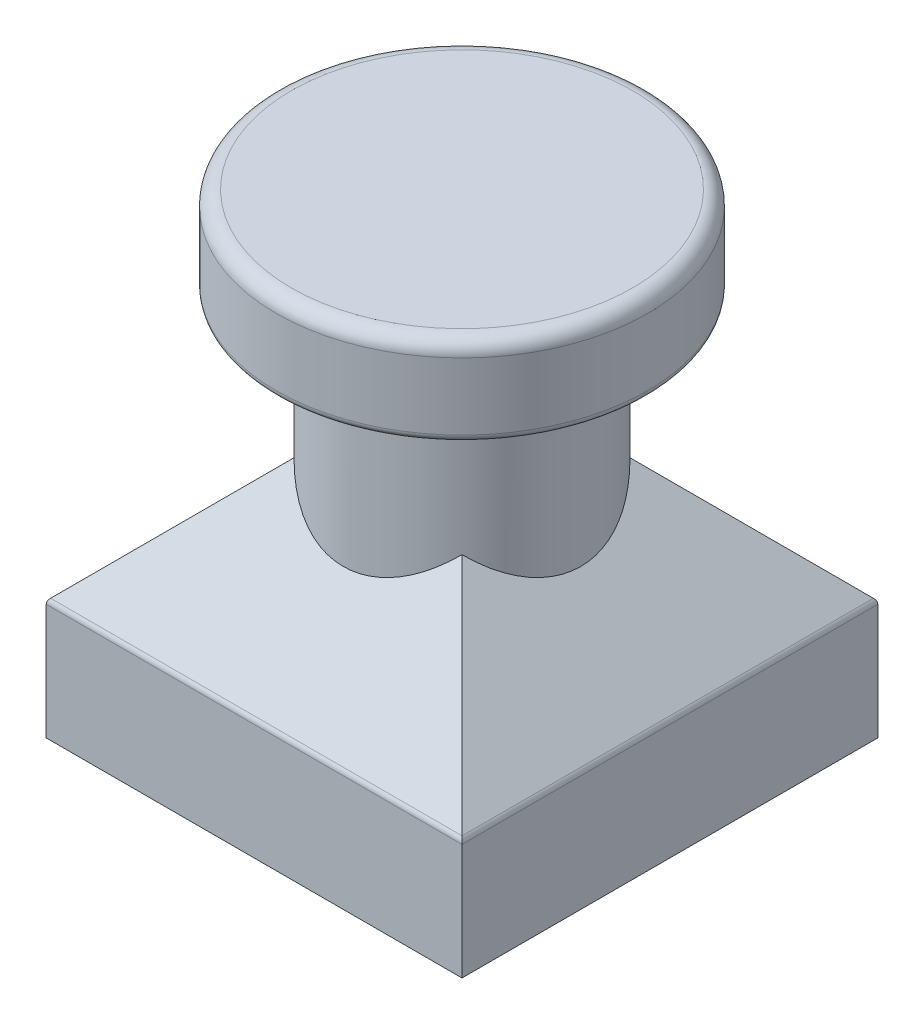
from build123d import *

# Parameters (mm, degrees)
SKIZZE1_W                       = 14
SKIZZE1_H                       = 14
AUFSATZ_LINEAR_AUSTRAGEN1_DEPTH = 16
FASE1_SIZE                      = 5
VERRUNDUNG2_R                   = 0.5
VERRUNDUNG3_R                   = 0.25
VERRUNDUNG4_R                   = 0.25


with BuildPart() as part:
    # Skizze1 → Aufsatz-Linear austragen1 (new body)
    with BuildSketch(Plane(origin=(0, 0, 0), x_dir=(1, 0, 0), z_dir=(0, 1, 0))):
        Rectangle(SKIZZE1_W, SKIZZE1_H)
    extrude(amount=AUFSATZ_LINEAR_AUSTRAGEN1_DEPTH)

    # Skizze6 → Schnitt-Rotation4 (revolve, cut)
    with BuildSketch(Plane(origin=(0, 0, 0), x_dir=(0, 0, -1), z_dir=(1, 0, 0))):
        Polygon((6.25, 16), (13.25, 16), (13.25, 9), (4, 9), (4, 13), (6.25, 13), align=None)
    revolve(axis=Axis((0, 0, 0), (0, 1, 0)), mode=Mode.SUBTRACT)

    # Fase1
    # the kernel refuses this chamfer: 5 mm, written as the material it takes off along each edge
    with BuildSketch(Plane(origin=(-7, 9, 19.85841494), x_dir=(0.9996219169112968, 0.027495876610586317, 0), z_dir=(0, 0, -1))) as fase1_piece_1_section:
        Polygon((FASE1_SIZE * 0.999621916911, FASE1_SIZE * 0.0274958766106), (-FASE1_SIZE * 0.0274958766106, FASE1_SIZE * 0.999621916911), (0, 0), align=None)
    fase1_piece_1 = extrude(amount=39.71682988, mode=Mode.PRIVATE)
    fase1_piece_1 = fase1_piece_1 - Plane(origin=(0, 7.328837599, 0), x_dir=(0, 0, -1), z_dir=(0, 1, 0)) * Cylinder(4, 100, mode=Mode.PRIVATE)
    add(fase1_piece_1, mode=Mode.SUBTRACT)
    with BuildSketch(Plane(origin=(-19.85841494, 9, -7), x_dir=(0, -0.9996219169112968, -0.027495876610586317), z_dir=(1, 0, 0))) as fase1_piece_2_section:
        Polygon((FASE1_SIZE * 0.999621916911, -FASE1_SIZE * 0.0274958766106), (-FASE1_SIZE * 0.0274958766106, -FASE1_SIZE * 0.999621916911), (0, 0), align=None)
    fase1_piece_2 = extrude(amount=39.71682988, mode=Mode.PRIVATE)
    fase1_piece_2 = fase1_piece_2 - Plane(origin=(0, 7.328837565, 0), x_dir=(0, 0, -1), z_dir=(0, 1, 0)) * Cylinder(4, 100, mode=Mode.PRIVATE)
    add(fase1_piece_2, mode=Mode.SUBTRACT)
    with BuildSketch(Plane(origin=(7, 9, -19.85841494), x_dir=(0.027495876610586317, -0.9996219169112968, 0), z_dir=(0, 0, 1))) as fase1_piece_3_section:
        Polygon((FASE1_SIZE * 0.999621916911, -FASE1_SIZE * 0.0274958766106), (-FASE1_SIZE * 0.0274958766106, -FASE1_SIZE * 0.999621916911), (0, 0), align=None)
    fase1_piece_3 = extrude(amount=39.71682988, mode=Mode.PRIVATE)
    fase1_piece_3 = fase1_piece_3 - Plane(origin=(0, 7.328837548, 0), x_dir=(0, 0, -1), z_dir=(0, 1, 0)) * Cylinder(4, 100, mode=Mode.PRIVATE)
    add(fase1_piece_3, mode=Mode.SUBTRACT)
    with BuildSketch(Plane(origin=(19.85841494, 9, 7), x_dir=(0, 0.027495876610586317, -0.9996219169112968), z_dir=(-1, 0, 0))) as fase1_piece_4_section:
        Polygon((FASE1_SIZE * 0.999621916911, FASE1_SIZE * 0.0274958766106), (-FASE1_SIZE * 0.0274958766106, FASE1_SIZE * 0.999621916911), (0, 0), align=None)
    fase1_piece_4 = extrude(amount=39.71682988, mode=Mode.PRIVATE)
    fase1_piece_4 = fase1_piece_4 - Plane(origin=(0, 7.328837599, 0), x_dir=(0, 0, -1), z_dir=(0, 1, 0)) * Cylinder(4, 100, mode=Mode.PRIVATE)
    add(fase1_piece_4, mode=Mode.SUBTRACT)

    # Verrundung2
    verrundung2_edges = [part.edges().sort_by_distance(p)[0] for p in [
        (0, 16, 6.25),
    ]]
    fillet(verrundung2_edges, radius=VERRUNDUNG2_R)

    # Verrundung3
    verrundung3_edges = [part.edges().sort_by_distance(p)[0] for p in [
        (-7, 4, 0),
        (0, 4, -7),
        (7, 4, 0),
        (0, 4, 7),
    ]]
    fillet(verrundung3_edges, radius=VERRUNDUNG3_R)

    # Verrundung4
    verrundung4_edges = [part.edges().sort_by_distance(p)[0] for p in [
        (0, 13, 6.25),
    ]]
    fillet(verrundung4_edges, radius=VERRUNDUNG4_R)


solid = part.part
